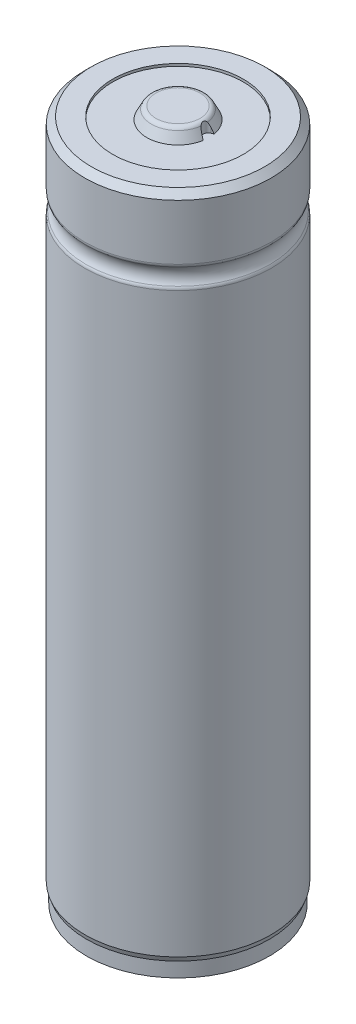
from build123d import *

# Parameters (mm, degrees)
CHAMFER_1_SIZE      = 0.2
CHAMFER_1_SIZE_2    = 0.549495484
FILLET_1_R          = 0.5
CUT_EXTRUDE_1_DEPTH = 1.2


with BuildPart() as part:
    # Sketch1 → Revolve1 (revolve)
    with BuildSketch(Plane.XY, mode=Mode.PRIVATE) as revolve1_sk:
        with BuildLine():
            Line((0, 68.75), (-2.5, 68.75))
            Line((-2.5, 68.75), (-3.1, 67.55))
            Line((-3.1, 67.55), (-6.5, 67.55))
            Line((-6.5, 67.55), (-6.5, 67.8))
            Line((-6.5, 67.8), (-8.625, 67.8))
            Line((-8.625, 67.8), (-9.275, 67.15))
            Line((-9.275, 67.15), (-9.275, 61.45))
            ThreePointArc((-9.275, 61.45), (-8.9, 60.5), (-9.275, 59.55))
            Line((-9.275, 59.55), (-9.275, 2))
            Line((-9.275, 2), (-9.1, 2))
            Line((-9.1, 2), (-9.1, 0))
            Line((-9.1, 0), (-7, 0))
            Line((-7, 0), (-7, 0.25))
            Line((-7, 0.25), (0, 0.25))
            Line((0, 0.25), (0, 68.75))
        make_face()
    revolve(revolve1_sk.sketch.rotate(Axis((0, 93.422769263, 0), (0, -1, 0)), 270), axis=Axis((0, 93.422769263, 0), (0, -1, 0)))

    # Фаска1
    # the kernel refuses this chamfer: 0.549495484, 0.2 mm, written as the material it adds along each edge
    with BuildSketch(Plane(origin=(0, 2, 0), x_dir=(0, 0, 1), z_dir=(1, 0, 0))) as chamfer_1_piece_1_section:
        Polygon((9.1 + CHAMFER_1_SIZE, 0), (9.1, CHAMFER_1_SIZE_2), (9.1, 0), align=None)
    chamfer_1_piece_1 = revolve(axis=Axis((0, 2, 0), (0, -1, 0)), mode=Mode.PRIVATE)
    chamfer_1_piece_1 = chamfer_1_piece_1 & Plane(origin=(0, 1.685840324, 0), x_dir=(0, 0, 1), z_dir=(0, -1, 0)) * Cylinder(9.275, 38, mode=Mode.PRIVATE)
    add(chamfer_1_piece_1)

    # Скругление1
    fillet_1_edges = [part.edges().sort_by_distance(p)[0] for p in [
        (0, 61.45, -9.275),
        (0, 59.55, -9.275),
        (0, 68.75, -2.5),
    ]]
    fillet(fillet_1_edges, radius=FILLET_1_R)

    # Эскиз1 → Вырез-Вытянуть1 (cut)
    with BuildSketch(Plane(origin=(0, 68.75, 0), x_dir=(1, 0, 0), z_dir=(0, 1, 0))):
        with BuildLine():
            Line((-2.830089464, -0.470245053), (-3.050819562, -0.55))
            ThreePointArc((-3.050819562, -0.55), (-3.1, 0), (-3.050819562, 0.55))
            Line((-3.050819562, 0.55), (-2.830089464, 0.470245053))
            ThreePointArc((-2.830089464, 0.470245053), (-2.5, 0), (-2.830089464, -0.470245053))
        make_face()
        with BuildLine():
            Line((2.830089464, 0.470245053), (3.050819562, 0.55))
            ThreePointArc((3.050819562, 0.55), (3.1, 0), (3.050819562, -0.55))
            Line((3.050819562, -0.55), (2.830089464, -0.470245053))
            ThreePointArc((2.830089464, -0.470245053), (2.5, 0), (2.830089464, 0.470245053))
        make_face()
    extrude(amount=-CUT_EXTRUDE_1_DEPTH, mode=Mode.SUBTRACT)


solid = part.part
